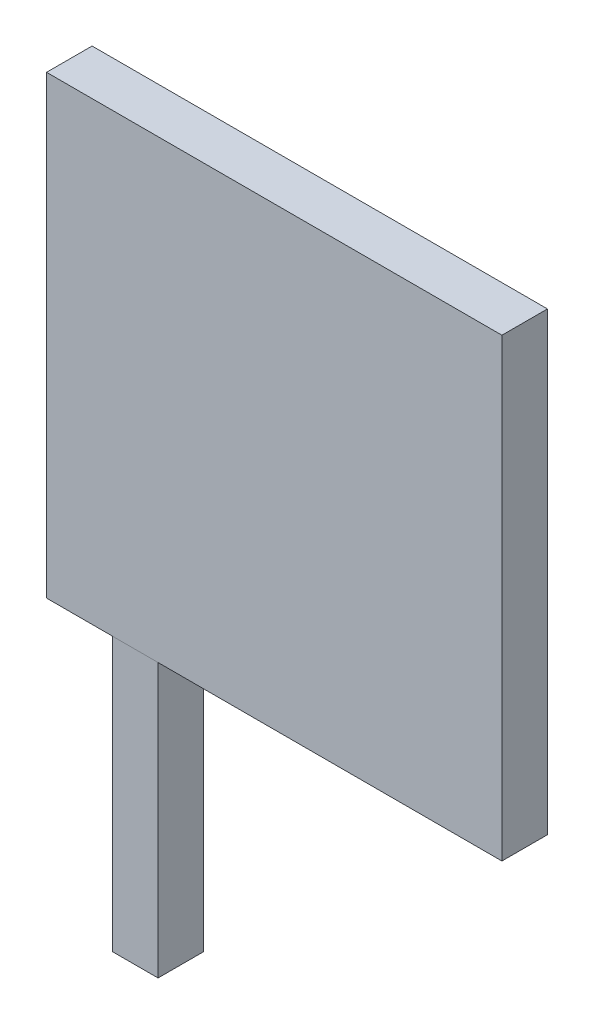
from build123d import *

# Parameters (mm, degrees)
SKETCH1_W             = 10
SKETCH1_H             = 10
BOSS_EXTRUDE1_DEPTH   = 1
SKETCH2_W             = 1
SKETCH2_H             = 1
BOSS_EXTRUDE2_DEPTH   = 6
BODY_MOVE_COPY1_ANGLE = 90
BODY_MOVE_COPY2_ANGLE = 90


with BuildPart() as part:
    # Sketch1 → Boss-Extrude1 (new body)
    with BuildSketch(Plane(origin=(0, 0, 0), x_dir=(1, 0, 0), z_dir=(0, 1, 0))):
        with Locations((-0.035587189, 0.231316726)):
            Rectangle(SKETCH1_W, SKETCH1_H)
    extrude(amount=BOSS_EXTRUDE1_DEPTH)


with BuildPart() as body_2:
    # Sketch2 → Boss-Extrude2 (new body)
    with BuildSketch(Plane.XY.offset(4.768683274)):
        with Locations((-3.086831355, 0.5)):
            Rectangle(SKETCH2_W, SKETCH2_H)
    extrude(amount=BOSS_EXTRUDE2_DEPTH)


with BuildPart() as part_1:
    # Body-Move/Copy1: moved
    add(part.part.rotate(Axis((0, 0.5, -0.231316726), (1, 0, 0)), BODY_MOVE_COPY1_ANGLE))


with BuildPart() as body_2_1:
    # Body-Move/Copy2: moved
    add(body_2.part.rotate(Axis((0, 0.5, 7.768683274), (1, 0, 0)), BODY_MOVE_COPY2_ANGLE))


with BuildPart() as body_2_2:
    # Body-Move/Copy3: read off the stored shape, not the designer's step
    # Body-Move/Copy3: moved
    add(body_2_1.part.moved(Location((0, -8, -8))))


solid = Compound([part_1.part, body_2_2.part])
